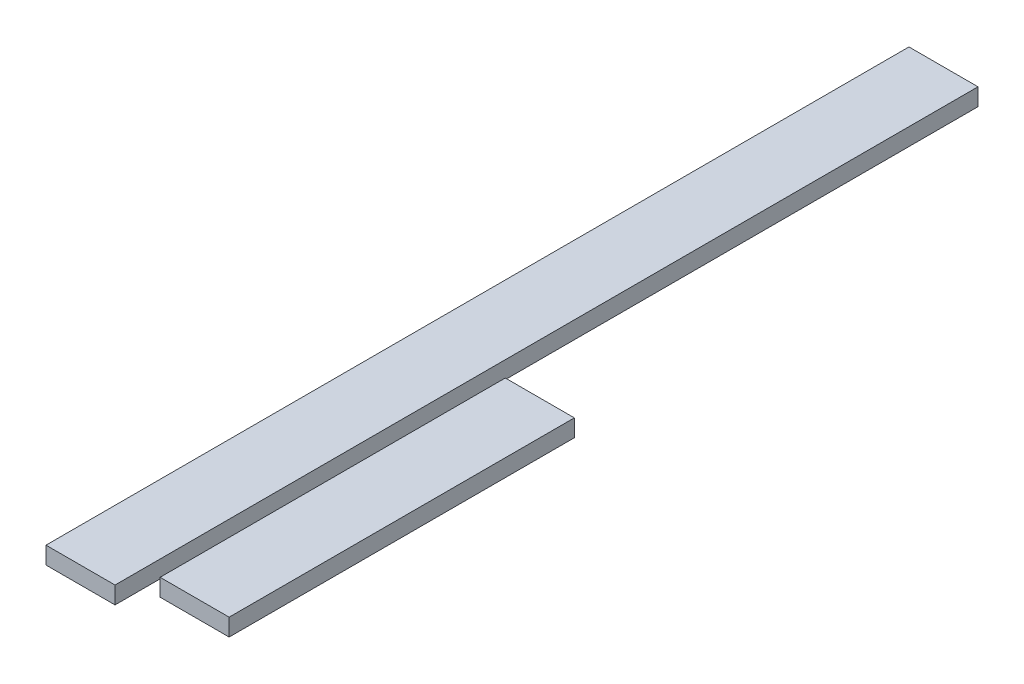
from build123d import *

# Parameters (mm, degrees)
SKETCH2_W           = 12
SKETCH2_H           = 150
BOSS_EXTRUDE4_DEPTH = 3
SKETCH3_W           = 12
SKETCH3_H           = 60
BOSS_EXTRUDE5_DEPTH = 3


with BuildPart() as part:
    # Sketch2 → Boss-Extrude4 (new body)
    with BuildSketch(Plane(origin=(0, 0, 0), x_dir=(1, 0, 0), z_dir=(0, 1, 0))):
        with Locations((63.836257857, 91.57184727)):
            Rectangle(SKETCH2_W, SKETCH2_H)
    extrude(amount=BOSS_EXTRUDE4_DEPTH)


with BuildPart() as body_2:
    # Sketch3 → Boss-Extrude5 (new body)
    with BuildSketch(Plane(origin=(0, 0, 0), x_dir=(1, 0, 0), z_dir=(0, 1, 0))):
        with Locations((99.629560174, 43.26681982)):
            Rectangle(SKETCH3_W, SKETCH3_H)
    extrude(amount=BOSS_EXTRUDE5_DEPTH)


with BuildPart() as body_2_1:
    # Body-Move/Copy1: moved
    add(body_2.part.moved(Location((-21.037468304, 0, -8.38383851))))


solid = Compound([part.part, body_2_1.part])
